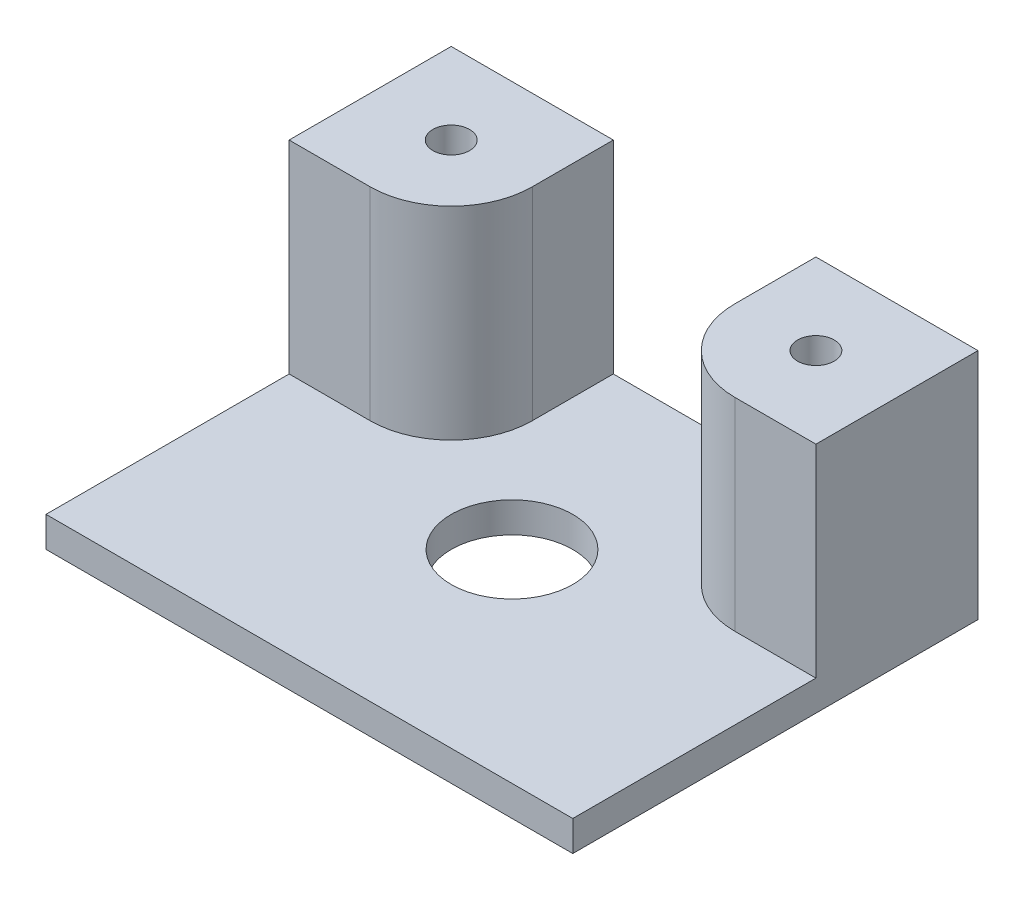
from build123d import *

# Parameters (mm, degrees)
SKETCH1_W                   = 165.1
SKETCH1_H                   = 127
BOSS_EXTRUDE1_DEPTH         = 9.525
SKETCH2_R                   = 19.05
CUT_EXTRUDE1_DEPTH          = 209.513154561
BOSS_EXTRUDE3_DEPTH         = 63.5
F_1_2_20_TAPPED_HOLE1_D     = 11.50874
F_1_2_20_TAPPED_HOLE1_DEPTH = 31.75
F_1_2_20_TAPPED_HOLE1_TIP   = 3.45757432


with BuildPart() as part:
    # Sketch1 → Boss-Extrude1 (new body)
    with BuildSketch(Plane(origin=(0, 0, 0), x_dir=(1, 0, 0), z_dir=(0, 1, 0))):
        with Locations((82.55, 63.5)):
            Rectangle(SKETCH1_W, SKETCH1_H)
    extrude(amount=BOSS_EXTRUDE1_DEPTH)

    # Sketch2 → Cut-Extrude1 (cut, through all)
    with BuildSketch(Plane(origin=(0, 9.525, 0), x_dir=(1, 0, 0), z_dir=(0, 1, 0))):
        with Locations((82.55, 63.5)):
            Circle(SKETCH2_R)
    extrude(amount=-CUT_EXTRUDE1_DEPTH, mode=Mode.SUBTRACT)

    # Sketch3 → Boss-Extrude3 (add)
    with BuildSketch(Plane(origin=(0, 9.525, 0), x_dir=(1, 0, 0), z_dir=(0, 1, 0))):
        with BuildLine():
            Line((0, 127), (50.8, 127))
            Line((50.8, 127), (50.8, 101.6))
            ThreePointArc((50.8, 101.6), (43.360512242, 83.639487758), (25.4, 76.2))
            Line((25.4, 76.2), (0, 76.2))
            Line((0, 76.2), (0, 127))
        make_face()
        with BuildLine():
            Line((165.1, 127), (114.3, 127))
            Line((114.3, 127), (114.3, 101.6))
            ThreePointArc((114.3, 101.6), (121.739487758, 83.639487758), (139.7, 76.2))
            Line((139.7, 76.2), (165.1, 76.2))
            Line((165.1, 76.2), (165.1, 127))
        make_face()
    extrude(amount=BOSS_EXTRUDE3_DEPTH)

    # 1/2-20 Tapped Hole1
    with Locations(Plane(origin=(25.4, 73.025, -101.6), x_dir=(0, 0, 1), z_dir=(0, 1, 0))):
        with Locations((0, 0), (0, 114.3)):
            Hole(F_1_2_20_TAPPED_HOLE1_D / 2, depth=F_1_2_20_TAPPED_HOLE1_DEPTH)
            with Locations((0, 0, -(F_1_2_20_TAPPED_HOLE1_DEPTH + F_1_2_20_TAPPED_HOLE1_TIP / 2))):  # 118° drill point
                Cone(0, F_1_2_20_TAPPED_HOLE1_D / 2, F_1_2_20_TAPPED_HOLE1_TIP, mode=Mode.SUBTRACT)


solid = part.part
